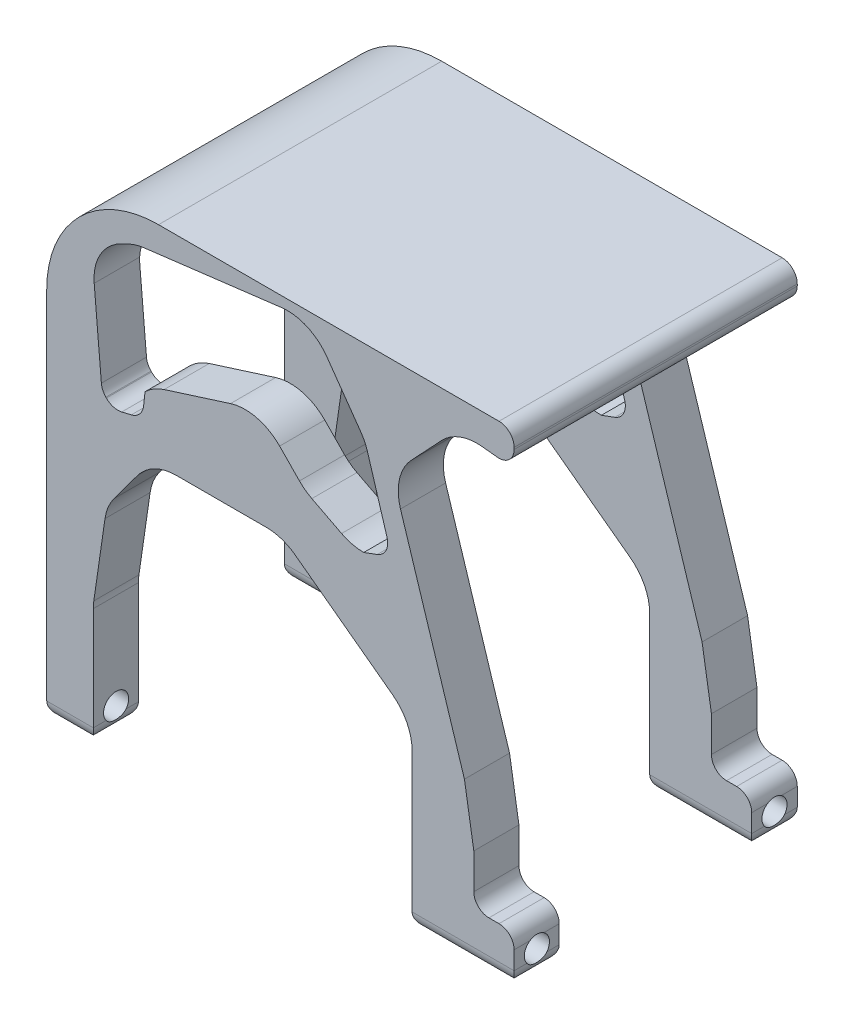
from build123d import *

# Parameters (mm, degrees)
SKETCH1_W           = 73.66
SKETCH1_H           = 76.2
BOSS_EXTRUDE1_DEPTH = 44.6278
CUT_EXTRUDE1_DEPTH  = 115.995113517
CUT_EXTRUDE2_DEPTH  = 46.4439
FILLET4_R           = 2.38
SKETCH4_R           = 1.9812
CUT_EXTRUDE3_DEPTH  = 110.4519
CUT_EXTRUDE4_DEPTH  = 110.4519
FILLET5_R           = 17.62
FILLET6_R           = 2.38
FILLET7_R           = 2.38
FILLET8_R           = 2.38


with BuildPart() as part:
    # Sketch1 → Boss-Extrude1 (new body)
    with BuildSketch(Plane.XY):
        with Locations((36.83, 38.1)):
            Rectangle(SKETCH1_W, SKETCH1_H)
    extrude(amount=BOSS_EXTRUDE1_DEPTH)

    # Sketch2 → Cut-Extrude1 (cut, through all)
    with BuildSketch(Plane(origin=(73.66, 0, 0), x_dir=(0, 0, -1), z_dir=(1, 0, 0))):
        with BuildLine():
            Line((-37.5158, 0), (-7.1755, 0))
            Line((-7.1755, 0), (-7.1755, 62.23))
            ThreePointArc((-7.1755, 62.23), (-9.407346327, 67.618153673), (-14.7955, 69.85))
            Line((-14.7955, 69.85), (-29.8958, 69.85))
            ThreePointArc((-29.8958, 69.85), (-35.283953673, 67.618153673), (-37.5158, 62.23))
            Line((-37.5158, 62.23), (-37.5158, 0))
        make_face()
    extrude(amount=-CUT_EXTRUDE1_DEPTH, mode=Mode.SUBTRACT)

    # Sketch3 → Cut-Extrude2 (cut)
    with BuildSketch(Plane.XY.offset(44.6278)):
        with BuildLine():
            Line((20.427124454, 43.381870678), (34.61278982, 43.381870678))
            ThreePointArc((34.61278982, 43.381870678), (37.003709607, 42.997055719), (39.153143383, 41.881477653))
            Line((39.153143383, 41.881477653), (54.502153562, 30.493502358))
            ThreePointArc((54.502153562, 30.493502358), (56.768484, 27.799308195), (57.5818, 24.373895383))
            Line((57.5818, 24.373895383), (57.5818, 0))
            Line((57.5818, 0), (7.3406, 0))
            Line((7.3406, 0), (7.3406, 18.650165871))
            ThreePointArc((7.3406, 18.650165871), (7.360436328, 19.199631206), (7.419842035, 19.746235813))
            Line((7.419842035, 19.746235813), (9.181194315, 31.864012906))
            ThreePointArc((9.181194315, 31.864012906), (9.678007008, 33.674355704), (10.602345305, 35.308296527))
            Line((10.602345305, 35.308296527), (14.307517479, 40.30222424))
            ThreePointArc((14.307517479, 40.30222424), (17.001711643, 42.568554678), (20.427124454, 43.381870678))
        make_face()
    extrude(amount=-CUT_EXTRUDE2_DEPTH, mode=Mode.SUBTRACT)

    # Fillet4
    fillet4_edges = [part.edges().sort_by_distance(p)[0] for p in [
        (73.66, 0, 3.58775),
        (0, 0, 3.58775),
        (3.6703, 0, 37.5158),
        (3.6703, 0, 7.1755),
        (65.6209, 0, 7.1755),
        (65.6209, 0, 37.5158),
        (65.6209, 0, 0),
        (65.6209, 0, 44.6278),
        (57.5818, 0, 41.0718),
        (57.5818, 0, 3.58775),
        (7.3406, 0, 41.0718),
        (7.3406, 0, 3.58775),
        (3.6703, 0, 0),
        (73.66, 0, 41.0718),
        (0, 0, 41.0718),
        (3.6703, 0, 44.6278),
    ]]
    fillet(fillet4_edges, radius=FILLET4_R)

    # Sketch4 → Cut-Extrude3 (cut)
    with BuildSketch(Plane.ZY):
        with Locations(Location((3.589828012, 3.5814, 0), (0, 0, 322.670336112))):
            Circle(SKETCH4_R)
    cut_extrude3 = extrude(amount=-CUT_EXTRUDE3_DEPTH, mode=Mode.SUBTRACT)

    # Mirror1: Cut-Extrude3 across plane
    add(cut_extrude3.mirror(Plane(origin=(0, 0, 22.3139), x_dir=(1, 0, 0), z_dir=(0, 0, -1))), mode=Mode.SUBTRACT)

    # Sketch5 → Cut-Extrude4 (cut)
    with BuildSketch(Plane(origin=(0, 0, 0), x_dir=(-1, 0, 0), z_dir=(0, 0, -1))):
        with BuildLine():
            Line((-73.66, 7.62), (-67.31, 7.62))
            Line((-67.31, 7.62), (-67.31, 15.566983381))
            Line((-67.31, 15.566983381), (-65.831491464, 24.622848165))
            Line((-65.831491464, 24.622848165), (-55.753365057, 56.456929991))
            ThreePointArc((-55.753365057, 56.456929991), (-55.588539842, 60.45013297), (-57.467474404, 63.977517596))
            Line((-57.467474404, 63.977517596), (-62.244068158, 69.055861999))
            ThreePointArc((-62.244068158, 69.055861999), (-65.135512171, 70.976119542), (-68.578693188, 71.414687668))
            Line((-68.578693188, 71.414687668), (-73.66, 70.889035239))
            Line((-73.66, 70.889035239), (-73.66, 7.62))
        make_face()
        with BuildLine():
            Line((-15.270880745, 71.893093388), (-37.008786782, 74.575511604))
            ThreePointArc((-37.008786782, 74.575511604), (-41.026040013, 73.980879106), (-44.167340518, 71.407138158))
            Line((-44.167340518, 71.407138158), (-49.481321462, 63.878843314))
            ThreePointArc((-49.481321462, 63.878843314), (-50.081782241, 62.871740905), (-50.520626517, 61.784439608))
            Line((-50.520626517, 61.784439608), (-53.633370493, 51.533922522))
            ThreePointArc((-53.633370493, 51.533922522), (-53.478465583, 49.667317913), (-52.086200463, 48.414398867))
            Line((-52.086200463, 48.414398867), (-49.959997173, 47.625836247))
            ThreePointArc((-49.959997173, 47.625836247), (-48.163107023, 47.84073086), (-46.467566482, 48.473294046))
            Line((-46.467566482, 48.473294046), (-41.780816915, 50.890133623))
            ThreePointArc((-41.780816915, 50.890133623), (-40.748966937, 51.531176462), (-39.832097155, 52.3280454))
            Line((-39.832097155, 52.3280454), (-36.703009437, 55.519613643))
            ThreePointArc((-36.703009437, 55.519613643), (-33.105269025, 57.578645331), (-28.96199718, 57.449626065))
            Line((-28.96199718, 57.449626065), (-18.504126334, 54.138842833))
            ThreePointArc((-18.504126334, 54.138842833), (-16.892093519, 53.413426277), (-15.490588967, 52.336085122))
            Line((-15.490588967, 52.336085122), (-15.490588967, 52.3280454))
            Line((-15.490588967, 52.3280454), (-15.264824581, 50.285432866))
            ThreePointArc((-15.264824581, 50.285432866), (-14.645496123, 48.884758298), (-13.333503282, 48.09473819))
            Line((-13.333503282, 48.09473819), (-11.814164437, 47.729747187))
            ThreePointArc((-11.814164437, 47.729747187), (-10.514749298, 47.759603177), (-9.400231313, 48.428348827))
            Line((-9.400231313, 48.428348827), (-9.319242372, 48.51160105))
            ThreePointArc((-9.319242372, 48.51160105), (-8.830080593, 49.226102939), (-8.609358059, 50.063404413))
            Line((-8.609358059, 50.063404413), (-7.477229718, 63.12531622))
            ThreePointArc((-7.477229718, 63.12531622), (-8.447013791, 67.553819052), (-11.760593249, 70.647733991))
            Line((-11.760593249, 70.647733991), (-12.895922143, 71.194883116))
            ThreePointArc((-12.895922143, 71.194883116), (-14.054858983, 71.641075285), (-15.270880745, 71.893093388))
        make_face()
    extrude(amount=-CUT_EXTRUDE4_DEPTH, mode=Mode.SUBTRACT)

    # Fillet5
    # the kernel refuses this fillet: 17.62 mm, written as the material it takes off along each edge
    with BuildSketch(Plane(origin=(0, 76.2, -44.05), x_dir=(0, -1, 0), z_dir=(0, 0, 1))) as fillet5_piece_1:
        with BuildLine():
            CenterArc((FILLET5_R, FILLET5_R), FILLET5_R, 180, 90)
            Line((0, FILLET5_R), (0, 0))
            Line((0, 0), (FILLET5_R, 0))
        make_face()
    extrude(amount=132.7278, mode=Mode.SUBTRACT)

    # Fillet6
    fillet6_edges = [part.edges().sort_by_distance(p)[0] for p in [
        (73.66, 70.889035239, 22.3139),
    ]]
    fillet(fillet6_edges, radius=FILLET6_R)

    # Fillet7
    # the kernel refuses this fillet: 2.38 mm, written as the material it adds along each edge
    with BuildSketch(Plane(origin=(67.31, 7.62, 37.5158), x_dir=(0, 1, 0), z_dir=(0, 0, 1))) as fillet7_piece_1:
        with BuildLine():
            CenterArc((FILLET7_R, -FILLET7_R), FILLET7_R, 90, 90)
            Line((0, -FILLET7_R), (0, 0))
            Line((0, 0), (FILLET7_R, 0))
        make_face()
    extrude(amount=7.112)
    with BuildSketch(Plane(origin=(67.31, 7.62, 0), x_dir=(0, 1, 0), z_dir=(0, 0, 1))) as fillet7_piece_2:
        with BuildLine():
            CenterArc((FILLET7_R, -FILLET7_R), FILLET7_R, 90, 90)
            Line((0, -FILLET7_R), (0, 0))
            Line((0, 0), (FILLET7_R, 0))
        make_face()
    extrude(amount=7.1755)
    # the kernel refuses this fillet: 2.38 mm, written as the material it takes off along each edge
    with BuildSketch(Plane(origin=(73.66, 7.62, 31.5658), x_dir=(-1, 0, 0), z_dir=(0, 0, 1))) as fillet7_2_piece_1:
        with BuildLine():
            CenterArc((FILLET7_R, FILLET7_R), FILLET7_R, 180, 90)
            Line((0, FILLET7_R), (0, 0))
            Line((0, 0), (FILLET7_R, 0))
        make_face()
    extrude(amount=19.012, mode=Mode.SUBTRACT)
    with BuildSketch(Plane(origin=(73.66, 7.62, -5.95), x_dir=(-1, 0, 0), z_dir=(0, 0, 1))) as fillet7_2_piece_2:
        with BuildLine():
            CenterArc((FILLET7_R, FILLET7_R), FILLET7_R, 180, 90)
            Line((0, FILLET7_R), (0, 0))
            Line((0, 0), (FILLET7_R, 0))
        make_face()
    extrude(amount=19.0755, mode=Mode.SUBTRACT)

    # Fillet8
    fillet8_edges = [part.edges().sort_by_distance(p)[0] for p in [
        (73.66, 76.2, 22.3139),
    ]]
    fillet(fillet8_edges, radius=FILLET8_R)


solid = part.part
